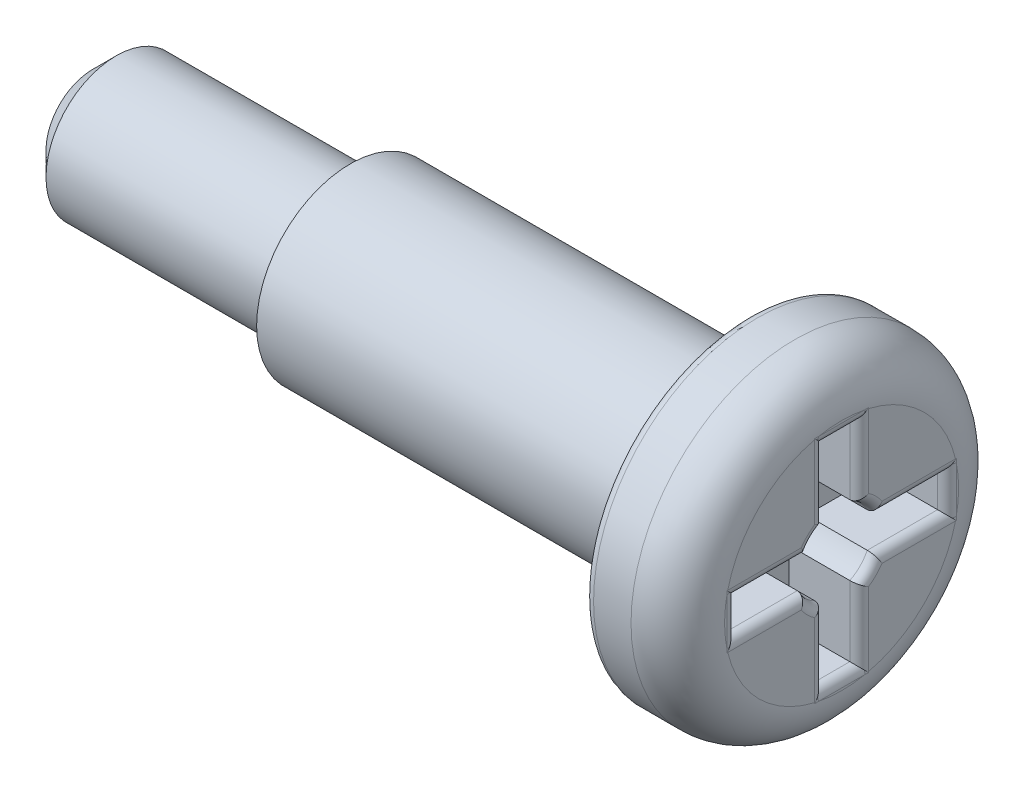
from build123d import *

# Parameters (mm, degrees)
ESQUISSE2_W                  = 0.75
ESQUISSE2_H                  = 2.25
ENL_V_MAT_EXTRU_1_DEPTH      = 1.5
R_P_TITION_CIRCULAIRE1_COUNT = 4
ESQUISSE3_R                  = 0.836492191
ENL_V_MAT_EXTRU_2_DEPTH      = 1.5
CONG_2_R                     = 0.2
CHANFREIN1_SIZE              = 0.5


with BuildPart() as part:
    # Esquisse1 → Révolution1 (revolve)
    with BuildSketch(Plane.XY, mode=Mode.PRIVATE) as r_volution1_sk:
        with BuildLine():
            Line((0, 0), (0, 1.5))
            Line((0, 1.5), (5.5, 1.5))
            Line((5.5, 1.5), (5.5, 2))
            Line((5.5, 2), (14, 2))
            Line((14, 2), (14, 3.5))
            Line((14, 3.5), (15, 3.5))
            ThreePointArc((15, 3.5), (15.707106781, 3.207106781), (16, 2.5))
            Line((16, 2.5), (16, 0))
            Line((16, 0), (0, 0))
        make_face()
    revolve(r_volution1_sk.sketch.rotate(Axis((0, 0, 0), (1, 0, 0)), 90), axis=Axis((0, 0, 0), (1, 0, 0)))

    # Esquisse2 → Enlèv. mat.-Extru.1 (cut)
    with BuildSketch(Plane(origin=(16, 0, 0), x_dir=(0, 0, -1), z_dir=(1, 0, 0))):
        with Locations((0, 1.125)):
            Rectangle(ESQUISSE2_W, ESQUISSE2_H)
    enl_v_mat_extru_1 = extrude(amount=-ENL_V_MAT_EXTRU_1_DEPTH, mode=Mode.SUBTRACT)

    # Répétition circulaire1: Enlèv. mat.-Extru.1 ×4 about axis
    r_p_tition_circulaire1_axis = Axis((0, 0, 0), (1, 0, 0))
    for i in range(1, R_P_TITION_CIRCULAIRE1_COUNT):
        add(enl_v_mat_extru_1.rotate(r_p_tition_circulaire1_axis, i * 360 / R_P_TITION_CIRCULAIRE1_COUNT), mode=Mode.SUBTRACT)

    # Esquisse3 → Enlèv. mat.-Extru.2 (cut)
    with BuildSketch(Plane(origin=(16, 0, 0), x_dir=(0, 0, -1), z_dir=(1, 0, 0))):
        Circle(ESQUISSE3_R)
    extrude(amount=-ENL_V_MAT_EXTRU_2_DEPTH, mode=Mode.SUBTRACT)

    # Congé2
    # the kernel refuses this fillet: 0.2 mm, written as the material it takes off along each edge
    with BuildSketch(Plane(origin=(14, 0, 0), x_dir=(0, 0, 1), z_dir=(0, 1, 0))) as cong_2_piece_1:
        with BuildLine():
            CenterArc((3.5 - CONG_2_R, CONG_2_R), CONG_2_R, 270, 90)
            Line((3.5, CONG_2_R), (3.5 + CONG_2_R * 0.02, CONG_2_R))
            Line((3.5 + CONG_2_R * 0.02, CONG_2_R), (3.5 + CONG_2_R * 0.02, -CONG_2_R * 0.02))
            Line((3.5 + CONG_2_R * 0.02, -CONG_2_R * 0.02), (3.5 - CONG_2_R, -CONG_2_R * 0.02))
            Line((3.5 - CONG_2_R, -CONG_2_R * 0.02), (3.5 - CONG_2_R, 0))
        make_face()
    revolve(axis=Axis((14, 0, 0), (1, 0, 0)), mode=Mode.SUBTRACT)
    with BuildSketch(Plane(origin=(16, -0.375, 2.25), x_dir=(0, 0, 1), z_dir=(0, 1, 0)), Plane(origin=(16, -2.25, -0.375), x_dir=(0, -1, 0), z_dir=(0, 0, 1)), Plane(origin=(16, 0.375, -2.25), x_dir=(0, 0, -1), z_dir=(0, -1, 0)), Plane(origin=(16, 2.25, 0.375), x_dir=(0, 1, 0), z_dir=(0, 0, -1))) as cong_2_piece_2:
        with BuildLine():
            CenterArc((CONG_2_R, -CONG_2_R), CONG_2_R, 90, 90)
            Line((0, -CONG_2_R), (-CONG_2_R * 0.02, -CONG_2_R))
            Line((-CONG_2_R * 0.02, -CONG_2_R), (-CONG_2_R * 0.02, CONG_2_R * 0.02))
            Line((-CONG_2_R * 0.02, CONG_2_R * 0.02), (CONG_2_R, CONG_2_R * 0.02))
            Line((CONG_2_R, CONG_2_R * 0.02), (CONG_2_R, 0))
        make_face()
    extrude(amount=0.75, mode=Mode.SUBTRACT)
    with BuildSketch(Plane(origin=(16, -0.375, 0.24772601), x_dir=(0, -1, 0), z_dir=(0, 0, 1)), Plane(origin=(16, -2.25, 0.375), x_dir=(0, 0, 1), z_dir=(0, 1, 0)), Plane(origin=(16, -0.24772601, -0.375), x_dir=(0, 0, -1), z_dir=(0, -1, 0)), Plane(origin=(16, -0.375, -2.25), x_dir=(0, -1, 0), z_dir=(0, 0, 1)), Plane(origin=(16, 0.375, -0.24772601), x_dir=(0, 1, 0), z_dir=(0, 0, -1)), Plane(origin=(16, 2.25, -0.375), x_dir=(0, 0, -1), z_dir=(0, -1, 0)), Plane(origin=(16, 0.24772601, 0.375), x_dir=(0, 0, 1), z_dir=(0, 1, 0)), Plane(origin=(16, 0.375, 2.25), x_dir=(0, 1, 0), z_dir=(0, 0, -1))) as cong_2_piece_3:
        with BuildLine():
            CenterArc((CONG_2_R, -CONG_2_R), CONG_2_R, 90, 90)
            Line((0, -CONG_2_R), (-CONG_2_R * 0.02, -CONG_2_R))
            Line((-CONG_2_R * 0.02, -CONG_2_R), (-CONG_2_R * 0.02, CONG_2_R * 0.02))
            Line((-CONG_2_R * 0.02, CONG_2_R * 0.02), (CONG_2_R, CONG_2_R * 0.02))
            Line((CONG_2_R, CONG_2_R * 0.02), (CONG_2_R, 0))
        make_face()
    extrude(amount=2.00227399, mode=Mode.SUBTRACT)
    with BuildSketch(Plane(origin=(16, 0, 0), x_dir=(0, 0.13251987061170517, 0.9911803488230871), z_dir=(0, 0.9911803488230871, -0.13251987061170517))) as cong_2_piece_4:
        with BuildLine():
            CenterArc((0.836492191 + CONG_2_R, -CONG_2_R), CONG_2_R, 90, 90)
            Line((0.836492191, -CONG_2_R), (0.836492191 - CONG_2_R * 0.02, -CONG_2_R))
            Line((0.836492191 - CONG_2_R * 0.02, -CONG_2_R), (0.836492191 - CONG_2_R * 0.02, CONG_2_R * 0.02))
            Line((0.836492191 - CONG_2_R * 0.02, CONG_2_R * 0.02), (0.836492191 + CONG_2_R, CONG_2_R * 0.02))
            Line((0.836492191 + CONG_2_R, CONG_2_R * 0.02), (0.836492191 + CONG_2_R, 0))
        make_face()
    revolve(axis=Axis((16, 0, 0), (1, 0, 0)), revolution_arc=105.230460742, mode=Mode.SUBTRACT)
    with BuildSketch(Plane(origin=(16, 0, 0), x_dir=(0, -0.9911803488230848, 0.1325198706117237), z_dir=(0, 0.1325198706117237, 0.9911803488230848))) as cong_2_piece_5:
        with BuildLine():
            CenterArc((0.836492191 + CONG_2_R, -CONG_2_R), CONG_2_R, 90, 90)
            Line((0.836492191, -CONG_2_R), (0.836492191 - CONG_2_R * 0.02, -CONG_2_R))
            Line((0.836492191 - CONG_2_R * 0.02, -CONG_2_R), (0.836492191 - CONG_2_R * 0.02, CONG_2_R * 0.02))
            Line((0.836492191 - CONG_2_R * 0.02, CONG_2_R * 0.02), (0.836492191 + CONG_2_R, CONG_2_R * 0.02))
            Line((0.836492191 + CONG_2_R, CONG_2_R * 0.02), (0.836492191 + CONG_2_R, 0))
        make_face()
    revolve(axis=Axis((16, 0, 0), (1, 0, 0)), revolution_arc=105.230460742, mode=Mode.SUBTRACT)
    with BuildSketch(Plane(origin=(16, 0, 0), x_dir=(0, -0.13251987061172962, -0.991180348823084), z_dir=(0, -0.991180348823084, 0.13251987061172962))) as cong_2_piece_6:
        with BuildLine():
            CenterArc((0.836492191 + CONG_2_R, -CONG_2_R), CONG_2_R, 90, 90)
            Line((0.836492191, -CONG_2_R), (0.836492191 - CONG_2_R * 0.02, -CONG_2_R))
            Line((0.836492191 - CONG_2_R * 0.02, -CONG_2_R), (0.836492191 - CONG_2_R * 0.02, CONG_2_R * 0.02))
            Line((0.836492191 - CONG_2_R * 0.02, CONG_2_R * 0.02), (0.836492191 + CONG_2_R, CONG_2_R * 0.02))
            Line((0.836492191 + CONG_2_R, CONG_2_R * 0.02), (0.836492191 + CONG_2_R, 0))
        make_face()
    revolve(axis=Axis((16, 0, 0), (1, 0, 0)), revolution_arc=105.230460742, mode=Mode.SUBTRACT)
    with BuildSketch(Plane(origin=(16, 0, 0), x_dir=(0, 0.9911803488230839, -0.13251987061173062), z_dir=(0, -0.13251987061173062, -0.9911803488230839))) as cong_2_piece_7:
        with BuildLine():
            CenterArc((0.836492191 + CONG_2_R, -CONG_2_R), CONG_2_R, 90, 90)
            Line((0.836492191, -CONG_2_R), (0.836492191 - CONG_2_R * 0.02, -CONG_2_R))
            Line((0.836492191 - CONG_2_R * 0.02, -CONG_2_R), (0.836492191 - CONG_2_R * 0.02, CONG_2_R * 0.02))
            Line((0.836492191 - CONG_2_R * 0.02, CONG_2_R * 0.02), (0.836492191 + CONG_2_R, CONG_2_R * 0.02))
            Line((0.836492191 + CONG_2_R, CONG_2_R * 0.02), (0.836492191 + CONG_2_R, 0))
        make_face()
    revolve(axis=Axis((16, 0, 0), (1, 0, 0)), revolution_arc=105.230460742, mode=Mode.SUBTRACT)
    with BuildSketch(Plane(origin=(16, -0.875, 2.25), x_dir=(0, 0, 1), z_dir=(0, 1, 0))) as cong_2_piece_8a_section:
        with BuildLine():
            CenterArc((CONG_2_R, -CONG_2_R), CONG_2_R, 90, 90)
            Line((0, -CONG_2_R), (-CONG_2_R * 0.02, -CONG_2_R))
            Line((-CONG_2_R * 0.02, -CONG_2_R), (-CONG_2_R * 0.02, CONG_2_R * 0.02))
            Line((-CONG_2_R * 0.02, CONG_2_R * 0.02), (CONG_2_R, CONG_2_R * 0.02))
            Line((CONG_2_R, CONG_2_R * 0.02), (CONG_2_R, 0))
        make_face()
    cong_2_piece_8a = extrude(amount=1.25, mode=Mode.PRIVATE)
    cong_2_piece_8a = split(cong_2_piece_8a, bisect_by=Plane(origin=(15.954720977, -0.375, 2.295279023), z_dir=(0, -1, 0)), keep=Keep.TOP, mode=Mode.PRIVATE)
    with BuildSketch(Plane(origin=(16, -0.375, 0.24772601), x_dir=(0, -1, 0), z_dir=(0, 0, 1))) as cong_2_piece_8b_section:
        with BuildLine():
            CenterArc((CONG_2_R, -CONG_2_R), CONG_2_R, 90, 90)
            Line((0, -CONG_2_R), (-CONG_2_R * 0.02, -CONG_2_R))
            Line((-CONG_2_R * 0.02, -CONG_2_R), (-CONG_2_R * 0.02, CONG_2_R * 0.02))
            Line((-CONG_2_R * 0.02, CONG_2_R * 0.02), (CONG_2_R, CONG_2_R * 0.02))
            Line((CONG_2_R, CONG_2_R * 0.02), (CONG_2_R, 0))
        make_face()
    cong_2_piece_8b = extrude(amount=2.50227399, mode=Mode.PRIVATE)
    cong_2_piece_8b = split(cong_2_piece_8b, bisect_by=Plane(origin=(15.954720977, -0.420279023, 2.25), z_dir=(0, 0, 1)), keep=Keep.TOP, mode=Mode.PRIVATE)
    cong_2_piece_8 = cong_2_piece_8a & cong_2_piece_8b
    add(cong_2_piece_8, mode=Mode.SUBTRACT)
    with BuildSketch(Plane(origin=(16, -0.375, 2.25), x_dir=(0, 0, 1), z_dir=(0, 1, 0))) as cong_2_piece_9a_section:
        with BuildLine():
            CenterArc((CONG_2_R, -CONG_2_R), CONG_2_R, 90, 90)
            Line((0, -CONG_2_R), (-CONG_2_R * 0.02, -CONG_2_R))
            Line((-CONG_2_R * 0.02, -CONG_2_R), (-CONG_2_R * 0.02, CONG_2_R * 0.02))
            Line((-CONG_2_R * 0.02, CONG_2_R * 0.02), (CONG_2_R, CONG_2_R * 0.02))
            Line((CONG_2_R, CONG_2_R * 0.02), (CONG_2_R, 0))
        make_face()
    cong_2_piece_9a = extrude(amount=1.25, mode=Mode.PRIVATE)
    cong_2_piece_9a = split(cong_2_piece_9a, bisect_by=Plane(origin=(15.954720977, 0.375, 2.295279023), z_dir=(0, 1, 0)), keep=Keep.TOP, mode=Mode.PRIVATE)
    with BuildSketch(Plane(origin=(16, 0.375, 2.75), x_dir=(0, 1, 0), z_dir=(0, 0, -1))) as cong_2_piece_9b_section:
        with BuildLine():
            CenterArc((CONG_2_R, -CONG_2_R), CONG_2_R, 90, 90)
            Line((0, -CONG_2_R), (-CONG_2_R * 0.02, -CONG_2_R))
            Line((-CONG_2_R * 0.02, -CONG_2_R), (-CONG_2_R * 0.02, CONG_2_R * 0.02))
            Line((-CONG_2_R * 0.02, CONG_2_R * 0.02), (CONG_2_R, CONG_2_R * 0.02))
            Line((CONG_2_R, CONG_2_R * 0.02), (CONG_2_R, 0))
        make_face()
    cong_2_piece_9b = extrude(amount=2.50227399, mode=Mode.PRIVATE)
    cong_2_piece_9b = split(cong_2_piece_9b, bisect_by=Plane(origin=(15.954720977, 0.420279023, 2.25), z_dir=(0, 0, 1)), keep=Keep.TOP, mode=Mode.PRIVATE)
    cong_2_piece_9 = cong_2_piece_9a & cong_2_piece_9b
    add(cong_2_piece_9, mode=Mode.SUBTRACT)
    with BuildSketch(Plane(origin=(16, -2.75, 0.375), x_dir=(0, 0, 1), z_dir=(0, 1, 0))) as cong_2_piece_10a_section:
        with BuildLine():
            CenterArc((CONG_2_R, -CONG_2_R), CONG_2_R, 90, 90)
            Line((0, -CONG_2_R), (-CONG_2_R * 0.02, -CONG_2_R))
            Line((-CONG_2_R * 0.02, -CONG_2_R), (-CONG_2_R * 0.02, CONG_2_R * 0.02))
            Line((-CONG_2_R * 0.02, CONG_2_R * 0.02), (CONG_2_R, CONG_2_R * 0.02))
            Line((CONG_2_R, CONG_2_R * 0.02), (CONG_2_R, 0))
        make_face()
    cong_2_piece_10a = extrude(amount=2.50227399, mode=Mode.PRIVATE)
    cong_2_piece_10a = split(cong_2_piece_10a, bisect_by=Plane(origin=(15.954720977, -2.25, 0.420279023), z_dir=(0, -1, 0)), keep=Keep.TOP, mode=Mode.PRIVATE)
    with BuildSketch(Plane(origin=(16, -2.25, -0.375), x_dir=(0, -1, 0), z_dir=(0, 0, 1))) as cong_2_piece_10b_section:
        with BuildLine():
            CenterArc((CONG_2_R, -CONG_2_R), CONG_2_R, 90, 90)
            Line((0, -CONG_2_R), (-CONG_2_R * 0.02, -CONG_2_R))
            Line((-CONG_2_R * 0.02, -CONG_2_R), (-CONG_2_R * 0.02, CONG_2_R * 0.02))
            Line((-CONG_2_R * 0.02, CONG_2_R * 0.02), (CONG_2_R, CONG_2_R * 0.02))
            Line((CONG_2_R, CONG_2_R * 0.02), (CONG_2_R, 0))
        make_face()
    cong_2_piece_10b = extrude(amount=1.25, mode=Mode.PRIVATE)
    cong_2_piece_10b = split(cong_2_piece_10b, bisect_by=Plane(origin=(15.954720977, -2.295279023, 0.375), z_dir=(0, 0, 1)), keep=Keep.TOP, mode=Mode.PRIVATE)
    cong_2_piece_10 = cong_2_piece_10a & cong_2_piece_10b
    add(cong_2_piece_10, mode=Mode.SUBTRACT)
    with BuildSketch(Plane(origin=(16, -2.25, -0.875), x_dir=(0, -1, 0), z_dir=(0, 0, 1))) as cong_2_piece_11a_section:
        with BuildLine():
            CenterArc((CONG_2_R, -CONG_2_R), CONG_2_R, 90, 90)
            Line((0, -CONG_2_R), (-CONG_2_R * 0.02, -CONG_2_R))
            Line((-CONG_2_R * 0.02, -CONG_2_R), (-CONG_2_R * 0.02, CONG_2_R * 0.02))
            Line((-CONG_2_R * 0.02, CONG_2_R * 0.02), (CONG_2_R, CONG_2_R * 0.02))
            Line((CONG_2_R, CONG_2_R * 0.02), (CONG_2_R, 0))
        make_face()
    cong_2_piece_11a = extrude(amount=1.25, mode=Mode.PRIVATE)
    cong_2_piece_11a = split(cong_2_piece_11a, bisect_by=Plane(origin=(15.954720977, -2.295279023, -0.375), z_dir=(0, 0, -1)), keep=Keep.TOP, mode=Mode.PRIVATE)
    with BuildSketch(Plane(origin=(16, -0.24772601, -0.375), x_dir=(0, 0, -1), z_dir=(0, -1, 0))) as cong_2_piece_11b_section:
        with BuildLine():
            CenterArc((CONG_2_R, -CONG_2_R), CONG_2_R, 90, 90)
            Line((0, -CONG_2_R), (-CONG_2_R * 0.02, -CONG_2_R))
            Line((-CONG_2_R * 0.02, -CONG_2_R), (-CONG_2_R * 0.02, CONG_2_R * 0.02))
            Line((-CONG_2_R * 0.02, CONG_2_R * 0.02), (CONG_2_R, CONG_2_R * 0.02))
            Line((CONG_2_R, CONG_2_R * 0.02), (CONG_2_R, 0))
        make_face()
    cong_2_piece_11b = extrude(amount=2.50227399, mode=Mode.PRIVATE)
    cong_2_piece_11b = split(cong_2_piece_11b, bisect_by=Plane(origin=(15.954720977, -2.25, -0.420279023), z_dir=(0, -1, 0)), keep=Keep.TOP, mode=Mode.PRIVATE)
    cong_2_piece_11 = cong_2_piece_11a & cong_2_piece_11b
    add(cong_2_piece_11, mode=Mode.SUBTRACT)
    with BuildSketch(Plane(origin=(16, -0.375, -2.75), x_dir=(0, -1, 0), z_dir=(0, 0, 1))) as cong_2_piece_12a_section:
        with BuildLine():
            CenterArc((CONG_2_R, -CONG_2_R), CONG_2_R, 90, 90)
            Line((0, -CONG_2_R), (-CONG_2_R * 0.02, -CONG_2_R))
            Line((-CONG_2_R * 0.02, -CONG_2_R), (-CONG_2_R * 0.02, CONG_2_R * 0.02))
            Line((-CONG_2_R * 0.02, CONG_2_R * 0.02), (CONG_2_R, CONG_2_R * 0.02))
            Line((CONG_2_R, CONG_2_R * 0.02), (CONG_2_R, 0))
        make_face()
    cong_2_piece_12a = extrude(amount=2.50227399, mode=Mode.PRIVATE)
    cong_2_piece_12a = split(cong_2_piece_12a, bisect_by=Plane(origin=(15.954720977, -0.420279023, -2.25), z_dir=(0, 0, -1)), keep=Keep.TOP, mode=Mode.PRIVATE)
    with BuildSketch(Plane(origin=(16, 0.375, -2.25), x_dir=(0, 0, -1), z_dir=(0, -1, 0))) as cong_2_piece_12b_section:
        with BuildLine():
            CenterArc((CONG_2_R, -CONG_2_R), CONG_2_R, 90, 90)
            Line((0, -CONG_2_R), (-CONG_2_R * 0.02, -CONG_2_R))
            Line((-CONG_2_R * 0.02, -CONG_2_R), (-CONG_2_R * 0.02, CONG_2_R * 0.02))
            Line((-CONG_2_R * 0.02, CONG_2_R * 0.02), (CONG_2_R, CONG_2_R * 0.02))
            Line((CONG_2_R, CONG_2_R * 0.02), (CONG_2_R, 0))
        make_face()
    cong_2_piece_12b = extrude(amount=1.25, mode=Mode.PRIVATE)
    cong_2_piece_12b = split(cong_2_piece_12b, bisect_by=Plane(origin=(15.954720977, -0.375, -2.295279023), z_dir=(0, -1, 0)), keep=Keep.TOP, mode=Mode.PRIVATE)
    cong_2_piece_12 = cong_2_piece_12a & cong_2_piece_12b
    add(cong_2_piece_12, mode=Mode.SUBTRACT)
    with BuildSketch(Plane(origin=(16, 0.875, -2.25), x_dir=(0, 0, -1), z_dir=(0, -1, 0))) as cong_2_piece_13a_section:
        with BuildLine():
            CenterArc((CONG_2_R, -CONG_2_R), CONG_2_R, 90, 90)
            Line((0, -CONG_2_R), (-CONG_2_R * 0.02, -CONG_2_R))
            Line((-CONG_2_R * 0.02, -CONG_2_R), (-CONG_2_R * 0.02, CONG_2_R * 0.02))
            Line((-CONG_2_R * 0.02, CONG_2_R * 0.02), (CONG_2_R, CONG_2_R * 0.02))
            Line((CONG_2_R, CONG_2_R * 0.02), (CONG_2_R, 0))
        make_face()
    cong_2_piece_13a = extrude(amount=1.25, mode=Mode.PRIVATE)
    cong_2_piece_13a = split(cong_2_piece_13a, bisect_by=Plane(origin=(15.954720977, 0.375, -2.295279023), z_dir=(0, 1, 0)), keep=Keep.TOP, mode=Mode.PRIVATE)
    with BuildSketch(Plane(origin=(16, 0.375, -0.24772601), x_dir=(0, 1, 0), z_dir=(0, 0, -1))) as cong_2_piece_13b_section:
        with BuildLine():
            CenterArc((CONG_2_R, -CONG_2_R), CONG_2_R, 90, 90)
            Line((0, -CONG_2_R), (-CONG_2_R * 0.02, -CONG_2_R))
            Line((-CONG_2_R * 0.02, -CONG_2_R), (-CONG_2_R * 0.02, CONG_2_R * 0.02))
            Line((-CONG_2_R * 0.02, CONG_2_R * 0.02), (CONG_2_R, CONG_2_R * 0.02))
            Line((CONG_2_R, CONG_2_R * 0.02), (CONG_2_R, 0))
        make_face()
    cong_2_piece_13b = extrude(amount=2.50227399, mode=Mode.PRIVATE)
    cong_2_piece_13b = split(cong_2_piece_13b, bisect_by=Plane(origin=(15.954720977, 0.420279023, -2.25), z_dir=(0, 0, -1)), keep=Keep.TOP, mode=Mode.PRIVATE)
    cong_2_piece_13 = cong_2_piece_13a & cong_2_piece_13b
    add(cong_2_piece_13, mode=Mode.SUBTRACT)
    with BuildSketch(Plane(origin=(16, 2.75, -0.375), x_dir=(0, 0, -1), z_dir=(0, -1, 0))) as cong_2_piece_14a_section:
        with BuildLine():
            CenterArc((CONG_2_R, -CONG_2_R), CONG_2_R, 90, 90)
            Line((0, -CONG_2_R), (-CONG_2_R * 0.02, -CONG_2_R))
            Line((-CONG_2_R * 0.02, -CONG_2_R), (-CONG_2_R * 0.02, CONG_2_R * 0.02))
            Line((-CONG_2_R * 0.02, CONG_2_R * 0.02), (CONG_2_R, CONG_2_R * 0.02))
            Line((CONG_2_R, CONG_2_R * 0.02), (CONG_2_R, 0))
        make_face()
    cong_2_piece_14a = extrude(amount=2.50227399, mode=Mode.PRIVATE)
    cong_2_piece_14a = split(cong_2_piece_14a, bisect_by=Plane(origin=(15.954720977, 2.25, -0.420279023), z_dir=(0, 1, 0)), keep=Keep.TOP, mode=Mode.PRIVATE)
    with BuildSketch(Plane(origin=(16, 2.25, 0.375), x_dir=(0, 1, 0), z_dir=(0, 0, -1))) as cong_2_piece_14b_section:
        with BuildLine():
            CenterArc((CONG_2_R, -CONG_2_R), CONG_2_R, 90, 90)
            Line((0, -CONG_2_R), (-CONG_2_R * 0.02, -CONG_2_R))
            Line((-CONG_2_R * 0.02, -CONG_2_R), (-CONG_2_R * 0.02, CONG_2_R * 0.02))
            Line((-CONG_2_R * 0.02, CONG_2_R * 0.02), (CONG_2_R, CONG_2_R * 0.02))
            Line((CONG_2_R, CONG_2_R * 0.02), (CONG_2_R, 0))
        make_face()
    cong_2_piece_14b = extrude(amount=1.25, mode=Mode.PRIVATE)
    cong_2_piece_14b = split(cong_2_piece_14b, bisect_by=Plane(origin=(15.954720977, 2.295279023, -0.375), z_dir=(0, 0, -1)), keep=Keep.TOP, mode=Mode.PRIVATE)
    cong_2_piece_14 = cong_2_piece_14a & cong_2_piece_14b
    add(cong_2_piece_14, mode=Mode.SUBTRACT)
    with BuildSketch(Plane(origin=(16, 2.25, 0.875), x_dir=(0, 1, 0), z_dir=(0, 0, -1))) as cong_2_piece_15a_section:
        with BuildLine():
            CenterArc((CONG_2_R, -CONG_2_R), CONG_2_R, 90, 90)
            Line((0, -CONG_2_R), (-CONG_2_R * 0.02, -CONG_2_R))
            Line((-CONG_2_R * 0.02, -CONG_2_R), (-CONG_2_R * 0.02, CONG_2_R * 0.02))
            Line((-CONG_2_R * 0.02, CONG_2_R * 0.02), (CONG_2_R, CONG_2_R * 0.02))
            Line((CONG_2_R, CONG_2_R * 0.02), (CONG_2_R, 0))
        make_face()
    cong_2_piece_15a = extrude(amount=1.25, mode=Mode.PRIVATE)
    cong_2_piece_15a = split(cong_2_piece_15a, bisect_by=Plane(origin=(15.954720977, 2.295279023, 0.375), z_dir=(0, 0, 1)), keep=Keep.TOP, mode=Mode.PRIVATE)
    with BuildSketch(Plane(origin=(16, 0.24772601, 0.375), x_dir=(0, 0, 1), z_dir=(0, 1, 0))) as cong_2_piece_15b_section:
        with BuildLine():
            CenterArc((CONG_2_R, -CONG_2_R), CONG_2_R, 90, 90)
            Line((0, -CONG_2_R), (-CONG_2_R * 0.02, -CONG_2_R))
            Line((-CONG_2_R * 0.02, -CONG_2_R), (-CONG_2_R * 0.02, CONG_2_R * 0.02))
            Line((-CONG_2_R * 0.02, CONG_2_R * 0.02), (CONG_2_R, CONG_2_R * 0.02))
            Line((CONG_2_R, CONG_2_R * 0.02), (CONG_2_R, 0))
        make_face()
    cong_2_piece_15b = extrude(amount=2.50227399, mode=Mode.PRIVATE)
    cong_2_piece_15b = split(cong_2_piece_15b, bisect_by=Plane(origin=(15.954720977, 2.25, 0.420279023), z_dir=(0, 1, 0)), keep=Keep.TOP, mode=Mode.PRIVATE)
    cong_2_piece_15 = cong_2_piece_15a & cong_2_piece_15b
    add(cong_2_piece_15, mode=Mode.SUBTRACT)

    # Chanfrein1
    chanfrein1_edges = [part.edges().sort_by_distance(p)[0] for p in [
        (0, 0, -1.5),
    ]]
    chamfer(chanfrein1_edges, length=CHANFREIN1_SIZE)


solid = part.part
